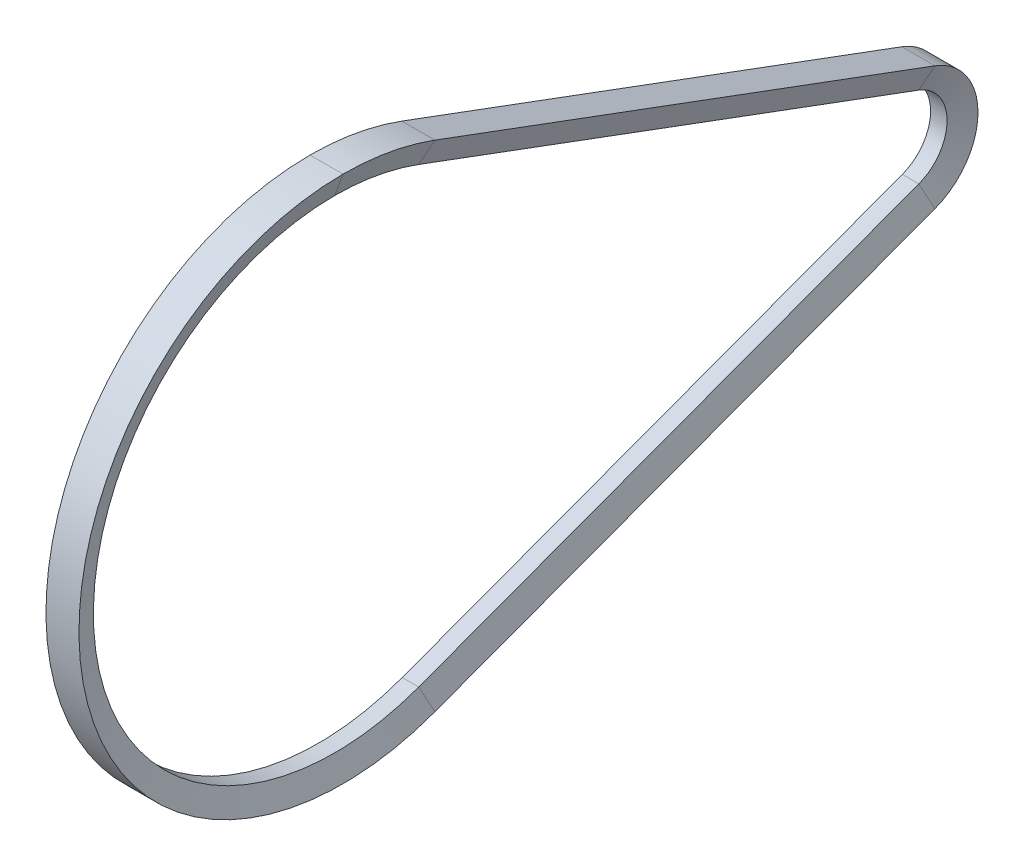
from build123d import *


with BuildPart() as part:
    # Barrer1: sweep along a path in Croquis1
    with BuildLine(Plane(origin=(0, 0, 0), x_dir=(0, 0, -1), z_dir=(1, 0, 0))) as barrer1_path:
        Line((227.787907193, 23.812098623), (35.35962877, 95.248394492))
        ThreePointArc((35.35962877, 95.248394492), (-101.6, 0), (35.35962877, -95.248394492))
        Line((35.35962877, -95.248394492), (227.787907193, -23.812098623))
        ThreePointArc((227.787907193, -23.812098623), (244.348, 0), (227.787907193, 23.812098623))
    # Croquis2 → Barrer1 (sweep)
    with BuildSketch(Plane.XY):
        Polygon((-6.35, 101.6), (6.35, 101.6), (3.172084892, 92.86875), (-3.172084892, 92.86875), align=None)
    sweep(path=barrer1_path.line)


solid = part.part
